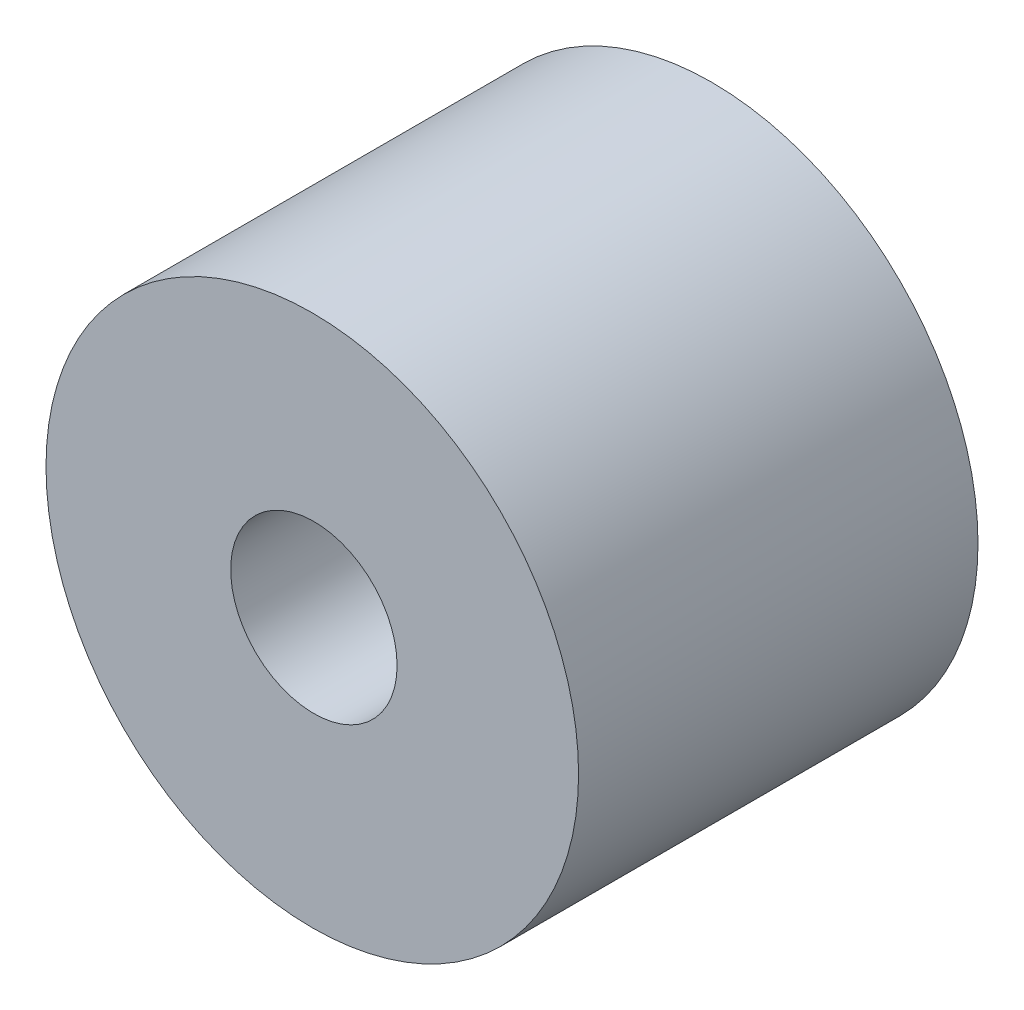
from build123d import *

# Parameters (mm, degrees)
SKETCH1_R           = 8
BOSS_EXTRUDE1_DEPTH = 12
HOLE1_START         = 7
HOLE1_OUTLINE_R     = 2.5
HOLE1_DEPTH         = 5


# Read off the part's stored shape, not the designer's step: Hole1
with BuildPart() as part:
    # Sketch1 → Boss-Extrude1 (new body)
    with BuildSketch(Plane.XY):
        Circle(SKETCH1_R)
    extrude(amount=BOSS_EXTRUDE1_DEPTH)

    # Hole1 outline → Hole1 (cut)
    with BuildSketch(Plane.XY.offset(HOLE1_START)):
        with Locations((0.047839015, 0.096480237)):
            Circle(HOLE1_OUTLINE_R)
    extrude(amount=HOLE1_DEPTH, mode=Mode.SUBTRACT)


solid = part.part
